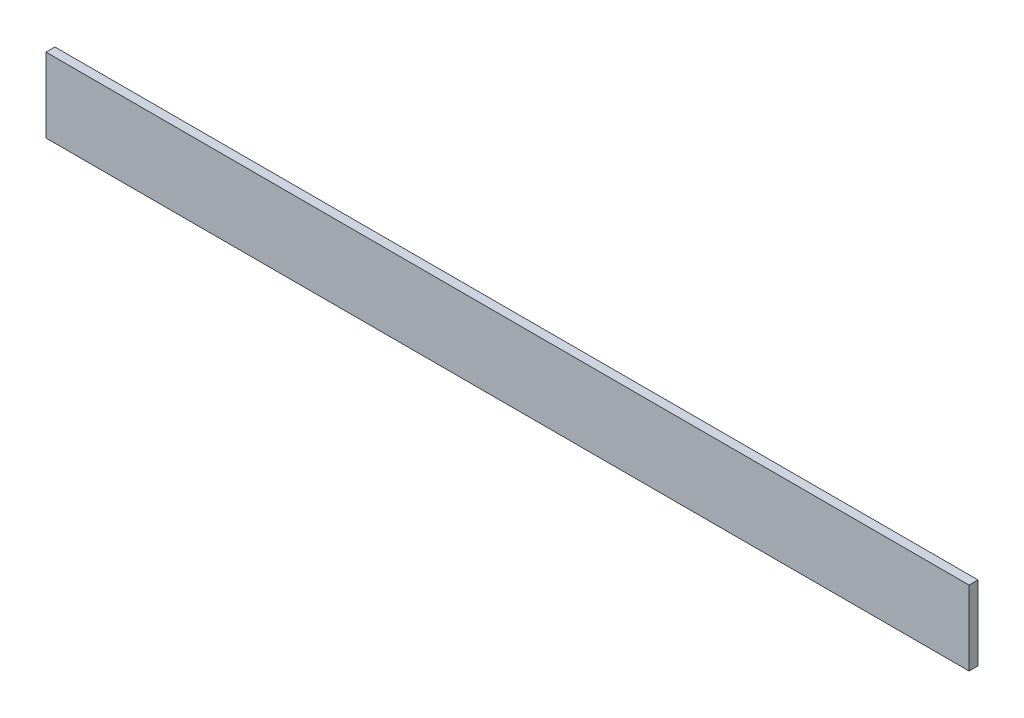
from build123d import *

# Parameters (mm, degrees)
EXTRUDE_1_DEPTH     = 310
SKETCH_2_W          = 22
SKETCH_2_H          = 22
CUT_EXTRUDE_1_DEPTH = 313.009615236


with BuildPart() as part:
    # Эскиз1 → Вытянуть-Тонкостенный1 (new body)
    with BuildSketch(Plane(origin=(0, 0, 0), x_dir=(0, 0, -1), z_dir=(1, 0, 0))):
        Polygon((0, 25), (0, 0), (25, 0), (25, 3), (3, 3), (3, 25), align=None)
    extrude(amount=EXTRUDE_1_DEPTH)

    # Эскиз2 → Вырез-Вытянуть1 (cut, through all)
    with BuildSketch(Plane.XZ):
        with Locations((299, -14)):
            Rectangle(SKETCH_2_W, SKETCH_2_H)
    extrude(amount=-CUT_EXTRUDE_1_DEPTH, mode=Mode.SUBTRACT)


solid = part.part
